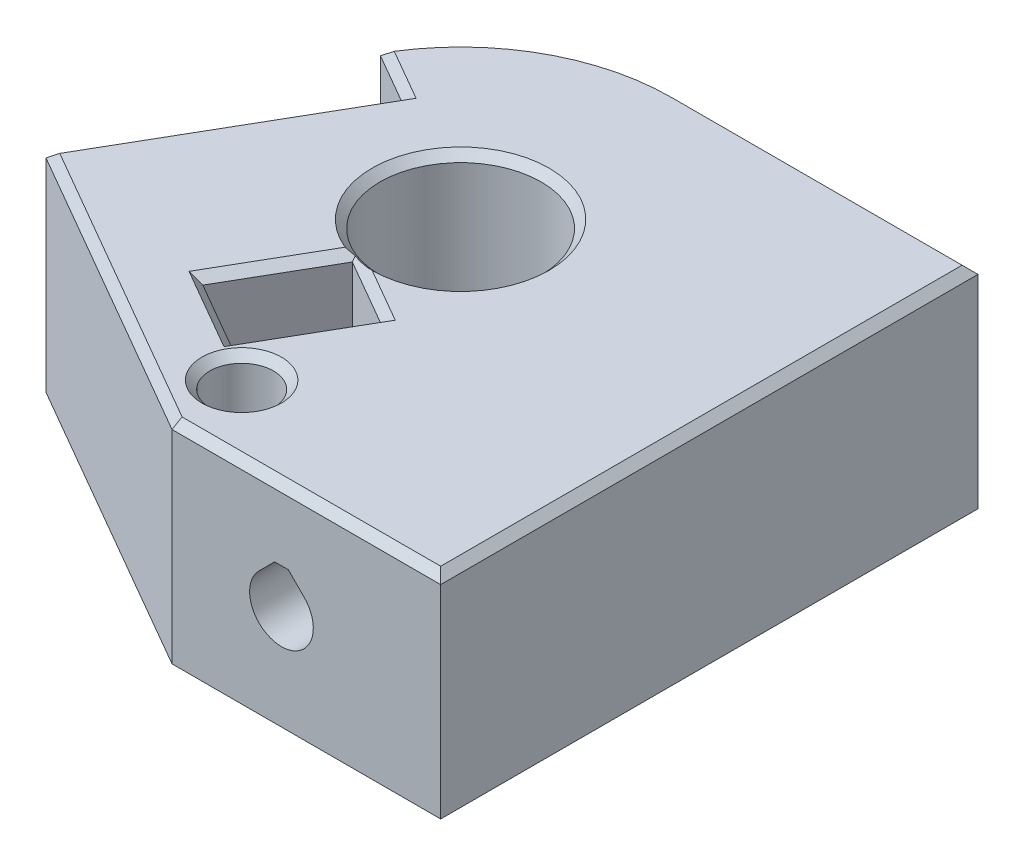
from build123d import *

# Parameters (mm, degrees)
SKETCH1_R           = 4.05
BOSS_EXTRUDE1_DEPTH = 11
SKETCH2_R           = 1.6
CUT_EXTRUDE1_DEPTH  = 47.310491369
SKETCH3_R           = 3.7
CUT_EXTRUDE2_DEPTH  = 11
SKETCH5_R           = 1.6
CUT_EXTRUDE4_DEPTH  = 47.310491451
SKETCH11_R          = 1.6
CUT_EXTRUDE10_DEPTH = 14
CUT_EXTRUDE9_START  = -9
CUT_EXTRUDE9_DEPTH  = 4
CUT_EXTRUDE15_DEPTH = 11
CUT_EXTRUDE16_DEPTH = 47.310491451
CUT_EXTRUDE17_REACH = 33.233


with BuildPart() as part:
    # Sketch1 → Boss-Extrude1 (new body)
    with BuildSketch(Plane(origin=(0, 0, 0), x_dir=(1, 0, 0), z_dir=(0, 1, 0))):
        with BuildLine():
            Line((-7.5, 0), (-21, 0))
            Line((-21, 0), (-35.981406461, 8.649519053))
            Line((-35.981406461, 8.649519053), (-29.42820323, 20))
            Line((-29.42820323, 20), (-32.026279442, 21.5))
            ThreePointArc((-32.026279442, 21.5), (-28, 25.526279442), (-22.5, 27))
            Line((-22.5, 27), (-7.5, 27))
            Line((-7.5, 27), (-7.5, 0))
        make_face()
        with Locations(Location((-22.5, 16, 0), (0, 0, 270))):
            Circle(SKETCH1_R, mode=Mode.SUBTRACT)
    extrude(amount=BOSS_EXTRUDE1_DEPTH)

    # Sketch2 → Cut-Extrude1 (cut, through all)
    with BuildSketch(Plane.XY):
        with Locations((-15.5, 5.5)):
            Circle(SKETCH2_R)
    extrude(amount=-CUT_EXTRUDE1_DEPTH, mode=Mode.SUBTRACT)

    # Sketch3 → Cut-Extrude2 (cut)
    with BuildSketch(Plane(origin=(0, 0, -27), x_dir=(-1, 0, 0), z_dir=(0, 0, -1))):
        with Locations((15.5, 5.5)):
            Circle(SKETCH3_R)
    extrude(amount=-CUT_EXTRUDE2_DEPTH, mode=Mode.SUBTRACT)

    # Sketch5 → Cut-Extrude4 (cut, through all)
    with BuildSketch(Plane(origin=(0, 11, 0), x_dir=(1, 0, 0), z_dir=(0, 1, 0))):
        with Locations(Location((-21, 3.5, 0), (0, 0, 270))):
            Circle(SKETCH5_R)
    extrude(amount=-CUT_EXTRUDE4_DEPTH, mode=Mode.SUBTRACT)

    # Sketch11 → Cut-Extrude10 (cut)
    with BuildSketch(Plane(origin=(-30.731406461, 0, -17.742785793), x_dir=(-0.49999999999999406, 0, 0.8660254037844421), z_dir=(-0.866025403784442, 0, -0.499999999999994))):
        with Locations((4.393593539, 5.5)):
            Circle(SKETCH11_R)
    extrude(amount=-CUT_EXTRUDE10_DEPTH, mode=Mode.SUBTRACT)

    # Sketch10 → Cut-Extrude9 (cut)
    with BuildSketch(Plane(origin=(-30.731406461, 0, -17.742785793), x_dir=(-0.49999999999999406, 0, 0.8660254037844421), z_dir=(-0.866025403784442, 0, -0.499999999999994)).offset(CUT_EXTRUDE9_START)):
        Polygon((1.643593539, 11), (7.143593539, 11), (7.143593539, 3.71228676), (4.393593539, 2.124573519), (1.643593539, 3.71228676), align=None)
    extrude(amount=-CUT_EXTRUDE9_DEPTH, mode=Mode.SUBTRACT)

    # Sketch17 → Cut-Extrude15 (cut)
    with BuildSketch(Plane(origin=(0, 0, -27), x_dir=(-1, 0, 0), z_dir=(0, 0, -1))):
        Polygon((15.5, 5.5), (18.11629509, 8.11629509), (16.292590181, 9.94), (14.707409819, 9.94), (12.88370491, 8.11629509), align=None)
    extrude(amount=-CUT_EXTRUDE15_DEPTH, mode=Mode.SUBTRACT)

    # Sketch18 → Cut-Extrude16 (cut, through all)
    with BuildSketch(Plane.XY):
        Polygon((-15.5, 5.5), (-14.36862915, 6.63137085), (-15.1572583, 7.42), (-15.8427417, 7.42), (-16.63137085, 6.63137085), align=None)
    extrude(amount=-CUT_EXTRUDE16_DEPTH, mode=Mode.SUBTRACT)

    # Cut-Extrude17: up to this face of the body (flat: up to its plane)
    cut_extrude17_end = Plane(part.part.faces().sort_by_distance((-20.803847577, 5.5, -6.937822174))[0])
    # Sketch19 → Cut-Extrude17 (cut, up to the picked face)
    with BuildSketch(Plane(origin=(-30.731406461, 0, -17.742785793), x_dir=(-0.49999999999999406, 0, 0.8660254037844421), z_dir=(-0.866025403784442, 0, -0.499999999999994)), mode=Mode.PRIVATE) as cut_extrude17_sk1:
        Polygon((4.393593539, 5.5), (5.524964389, 6.63137085), (4.736335239, 7.42), (4.05085184, 7.42), (3.26222269, 6.63137085), align=None)
    cut_extrude17_tool1 = split(extrude(cut_extrude17_sk1.sketch, amount=-CUT_EXTRUDE17_REACH, mode=Mode.PRIVATE), bisect_by=cut_extrude17_end, keep=Keep.BOTH, mode=Mode.PRIVATE)
    add(cut_extrude17_tool1.solids().sort_by(Axis((-32.928203, 6.587948, -13.937822), (0.866025403784442, 0, 0.499999999999994)))[0], mode=Mode.SUBTRACT)

    # Chamfer2
    # the kernel refuses this chamfer: 0.4 mm, written as the material it takes off along each edge
    with BuildSketch(Plane(origin=(-7.5, 11, -27), x_dir=(0.027495876610587302, -0.9996219169112966, 0), z_dir=(0, 0, 1)), Plane(origin=(-7.5, 0, -27), x_dir=(-0.9996219169112968, -0.027495876610586313, 0), z_dir=(0, 0, 1))) as chamfer2_piece_1:
        with BuildLine():
            Line((0.411469278, 0), (-0.022618862, -0.410847117))
            Line((-0.022618862, -0.410847117), (-0.030615837, -0.41062715))
            ThreePointArc((-0.030615837, -0.41062715), (-0.013651691, -0.205359132), (-0.007996975, 0.000219967))
            Line((-0.007996975, 0.000219967), (0.000219967, 0.007996975))
            ThreePointArc((0.000219967, 0.007996975), (0.205799066, 0.00234226), (0.411689245, 0.007996975))
            Line((0.411689245, 0.007996975), (0.411469278, 0))
        make_face()
    extrude(amount=27, mode=Mode.SUBTRACT)
    with BuildSketch(Plane(origin=(-22.5, 11, -27), x_dir=(0, -0.9996219169112966, -0.027495876610587302), z_dir=(1, 0, 0))) as chamfer2_piece_2:
        with BuildLine():
            Line((0.411469278, 0), (-0.022618862, -0.410847117))
            Line((-0.022618862, -0.410847117), (-0.030615837, -0.41062715))
            ThreePointArc((-0.030615837, -0.41062715), (-0.013651691, -0.205359132), (-0.007996975, 0.000219967))
            Line((-0.007996975, 0.000219967), (0.000219967, 0.007996975))
            ThreePointArc((0.000219967, 0.007996975), (0.205799066, 0.00234226), (0.411689245, 0.007996975))
            Line((0.411689245, 0.007996975), (0.411469278, 0))
        make_face()
    extrude(amount=15, mode=Mode.SUBTRACT)
    with BuildSketch(Plane(origin=(-22.5, 11, -16), x_dir=(-0.8660254037844412, 0, -0.4999999999999956), z_dir=(-0.4999999999999956, 0, 0.8660254037844412))) as chamfer2_piece_3:
        with BuildLine():
            Line((10.588686292, -0.011313708), (11.011313708, 0.411313708))
            Line((11.011313708, 0.411313708), (11.019313708, 0.411313708))
            ThreePointArc((11.019313708, 0.411313708), (11.008, 0.205656854), (11.008, 0))
            Line((11.008, 0), (11, -0.008))
            ThreePointArc((11, -0.008), (10.794343146, -0.008), (10.588686292, -0.019313708))
            Line((10.588686292, -0.019313708), (10.588686292, -0.011313708))
        make_face()
    revolve(axis=Axis((-22.5, 11, -16), (0, -1, 0)), revolution_arc=60, mode=Mode.SUBTRACT)
    with BuildSketch(Plane(origin=(-22.5, 0, -16), x_dir=(0, 0, 1), z_dir=(-1, 0, 0))) as chamfer2_piece_4:
        with BuildLine():
            Line((4.038686292, 0.411313708), (4.461313708, -0.011313708))
            Line((4.461313708, -0.011313708), (4.461313708, -0.019313708))
            ThreePointArc((4.461313708, -0.019313708), (4.255656854, -0.008), (4.05, -0.008))
            Line((4.05, -0.008), (4.042, 0))
            ThreePointArc((4.042, 0), (4.042, 0.205656854), (4.030686292, 0.411313708))
            Line((4.030686292, 0.411313708), (4.038686292, 0.411313708))
        make_face()
    revolve(axis=Axis((-22.5, 0, -16), (0, 1, 0)), mode=Mode.SUBTRACT)
    with BuildSketch(Plane(origin=(-22.5, 11, -16), x_dir=(0, 0, 1), z_dir=(-1, 0, 0))) as chamfer2_piece_5:
        with BuildLine():
            Line((4.038686292, -0.411313708), (4.461313708, 0.011313708))
            Line((4.461313708, 0.011313708), (4.461313708, 0.019313708))
            ThreePointArc((4.461313708, 0.019313708), (4.255656854, 0.008), (4.05, 0.008))
            Line((4.05, 0.008), (4.042, 0))
            ThreePointArc((4.042, 0), (4.042, -0.205656854), (4.030686292, -0.411313708))
            Line((4.030686292, -0.411313708), (4.038686292, -0.411313708))
        make_face()
    revolve(axis=Axis((-22.5, 11, -16), (0, 1, 0)), mode=Mode.SUBTRACT)
    with BuildSketch(Plane(origin=(-29.42820323, 11, -20), x_dir=(-0.013747938305293759, -0.9996219169112966, 0.023812127644091508), z_dir=(-0.8660254037844419, 0, -0.49999999999999445))) as chamfer2_piece_6_section:
        with BuildLine():
            Line((0.411469278, 0), (-0.022618862, -0.410847117))
            Line((-0.022618862, -0.410847117), (-0.030615837, -0.41062715))
            ThreePointArc((-0.030615837, -0.41062715), (-0.013651691, -0.205359132), (-0.007996975, 0.000219967))
            Line((-0.007996975, 0.000219967), (0.000219967, 0.007996975))
            ThreePointArc((0.000219967, 0.007996975), (0.205799066, 0.00234226), (0.411689245, 0.007996975))
            Line((0.411689245, 0.007996975), (0.411469278, 0))
        make_face()
    chamfer2_piece_6 = extrude(amount=4.028673195, mode=Mode.PRIVATE)
    chamfer2_piece_6 = chamfer2_piece_6 & Plane(origin=(-22.5, 10.868056462, -16), x_dir=(-0.8660254037844413, 0, -0.4999999999999957), z_dir=(0, -1, 0)) * Cylinder(11, 10, mode=Mode.PRIVATE)
    add(chamfer2_piece_6, mode=Mode.SUBTRACT)
    with BuildSketch(Plane(origin=(-35.981406461, 11, -8.649519053), x_dir=(-0.023812127644093392, -0.9996219169112966, -0.013747938305294813), z_dir=(0.4999999999999936, 0, -0.8660254037844424))) as chamfer2_piece_7:
        with BuildLine():
            Line((0.411469278, 0), (-0.022618862, -0.410847117))
            Line((-0.022618862, -0.410847117), (-0.030615837, -0.41062715))
            ThreePointArc((-0.030615837, -0.41062715), (-0.013651691, -0.205359132), (-0.007996975, 0.000219967))
            Line((-0.007996975, 0.000219967), (0.000219967, 0.007996975))
            ThreePointArc((0.000219967, 0.007996975), (0.205799066, 0.00234226), (0.411689245, 0.007996975))
            Line((0.411689245, 0.007996975), (0.411469278, 0))
        make_face()
    extrude(amount=13.106406461, mode=Mode.SUBTRACT)
    with BuildSketch(Plane(origin=(-20.109142881, 11, 0.514336598), x_dir=(-0.01374793830529188, -0.9996219169112968, 0.02381212764408828), z_dir=(-0.866025403784442, 0, -0.49999999999999406))) as chamfer2_piece_8_section:
        with BuildLine():
            Line((0.411469278, 0), (-0.022618862, -0.410847117))
            Line((-0.022618862, -0.410847117), (-0.030615837, -0.41062715))
            ThreePointArc((-0.030615837, -0.41062715), (-0.013651691, -0.205359132), (-0.007996975, 0.000219967))
            Line((-0.007996975, 0.000219967), (0.000219967, 0.007996975))
            ThreePointArc((0.000219967, 0.007996975), (0.205799066, 0.00234226), (0.411689245, 0.007996975))
            Line((0.411689245, 0.007996975), (0.411469278, 0))
        make_face()
    chamfer2_piece_8 = extrude(amount=18.327711301, mode=Mode.PRIVATE)
    chamfer2_piece_8 = split(chamfer2_piece_8, bisect_by=Plane(origin=(-28.324551367, 10.868619313, 0), z_dir=(0, 0, -1)), keep=Keep.TOP, mode=Mode.PRIVATE)
    add(chamfer2_piece_8, mode=Mode.SUBTRACT)
    with BuildSketch(Plane(origin=(-21, 0, -3.5), x_dir=(0, 0, 1), z_dir=(-1, 0, 0))) as chamfer2_piece_9:
        with BuildLine():
            Line((2.011313708, -0.011313708), (1.588686292, 0.411313708))
            Line((1.588686292, 0.411313708), (1.580686292, 0.411313708))
            ThreePointArc((1.580686292, 0.411313708), (1.592, 0.205656854), (1.592, 0))
            Line((1.592, 0), (1.6, -0.008))
            ThreePointArc((1.6, -0.008), (1.805656854, -0.008), (2.011313708, -0.019313708))
            Line((2.011313708, -0.019313708), (2.011313708, -0.011313708))
        make_face()
    revolve(axis=Axis((-21, 0, -3.5), (0, 1, 0)), mode=Mode.SUBTRACT)
    with BuildSketch(Plane(origin=(-21, 11, -3.5), x_dir=(0, 0, 1), z_dir=(-1, 0, 0))) as chamfer2_piece_10:
        with BuildLine():
            Line((1.588686292, -0.411313708), (2.011313708, 0.011313708))
            Line((2.011313708, 0.011313708), (2.011313708, 0.019313708))
            ThreePointArc((2.011313708, 0.019313708), (1.805656854, 0.008), (1.6, 0.008))
            Line((1.6, 0.008), (1.592, 0))
            ThreePointArc((1.592, 0), (1.592, -0.205656854), (1.580686292, -0.411313708))
            Line((1.580686292, -0.411313708), (1.588686292, -0.411313708))
        make_face()
    revolve(axis=Axis((-21, 11, -3.5), (0, 1, 0)), mode=Mode.SUBTRACT)
    with BuildSketch(Plane(origin=(-23.758974596, 11, -11.819392034), x_dir=(0.02381212764408691, -0.9996219169112968, 0.013747938305291089), z_dir=(-0.49999999999999406, 0, 0.8660254037844421))) as chamfer2_piece_11:
        with BuildLine():
            Line((0.411469278, 0), (-0.022618862, -0.410847117))
            Line((-0.022618862, -0.410847117), (-0.030615837, -0.41062715))
            ThreePointArc((-0.030615837, -0.41062715), (-0.013651691, -0.205359132), (-0.007996975, 0.000219967))
            Line((-0.007996975, 0.000219967), (0.000219967, 0.007996975))
            ThreePointArc((0.000219967, 0.007996975), (0.205799066, 0.00234226), (0.411689245, 0.007996975))
            Line((0.411689245, 0.007996975), (0.411469278, 0))
        make_face()
    extrude(amount=5.5, mode=Mode.SUBTRACT)
    with BuildSketch(Plane(origin=(-20.294872981, 11, -9.819392034), x_dir=(-0.02381212764409525, -0.9996219169112966, -0.013747938305295906), z_dir=(-0.49999999999999406, 0, 0.8660254037844421))) as chamfer2_piece_12:
        with BuildLine():
            Line((0.411469278, 0), (-0.022618862, 0.410847117))
            Line((-0.022618862, 0.410847117), (-0.030615837, 0.41062715))
            ThreePointArc((-0.030615837, 0.41062715), (-0.013651691, 0.205359132), (-0.007996975, -0.000219967))
            Line((-0.007996975, -0.000219967), (0.000219967, -0.007996975))
            ThreePointArc((0.000219967, -0.007996975), (0.205799066, -0.00234226), (0.411689245, -0.007996975))
            Line((0.411689245, -0.007996975), (0.411469278, 0))
        make_face()
    extrude(amount=5.5, mode=Mode.SUBTRACT)
    with BuildSketch(Plane(origin=(-23.758974596, 11, -11.819392034), x_dir=(-0.013747938305293748, -0.9996219169112966, 0.023812127644091515), z_dir=(0.8660254037844421, 0, 0.49999999999999406))) as chamfer2_piece_13:
        with BuildLine():
            Line((0.411469278, 0), (-0.022618862, 0.410847117))
            Line((-0.022618862, 0.410847117), (-0.030615837, 0.41062715))
            ThreePointArc((-0.030615837, 0.41062715), (-0.013651691, 0.205359132), (-0.007996975, -0.000219967))
            Line((-0.007996975, -0.000219967), (0.000219967, -0.007996975))
            ThreePointArc((0.000219967, -0.007996975), (0.205799066, -0.00234226), (0.411689245, -0.007996975))
            Line((0.411689245, -0.007996975), (0.411469278, 0))
        make_face()
    extrude(amount=4, mode=Mode.SUBTRACT)
    with BuildSketch(Plane(origin=(-26.508974596, 11, -7.056252313), x_dir=(0.01374793830529188, -0.9996219169112968, -0.02381212764408828), z_dir=(0.8660254037844421, 0, 0.49999999999999406))) as chamfer2_piece_14:
        with BuildLine():
            Line((0.411469278, 0), (-0.022618862, -0.410847117))
            Line((-0.022618862, -0.410847117), (-0.030615837, -0.41062715))
            ThreePointArc((-0.030615837, -0.41062715), (-0.013651691, -0.205359132), (-0.007996975, 0.000219967))
            Line((-0.007996975, 0.000219967), (0.000219967, 0.007996975))
            ThreePointArc((0.000219967, 0.007996975), (0.205799066, 0.00234226), (0.411689245, 0.007996975))
            Line((0.411689245, 0.007996975), (0.411469278, 0))
        make_face()
    extrude(amount=4, mode=Mode.SUBTRACT)
    with BuildSketch(Plane(origin=(-35.981406461, 0, -8.649519053), x_dir=(-0.023812127644093434, 0.9996219169112966, -0.013747938305294837), z_dir=(0.4999999999999936, 0, -0.8660254037844424))) as chamfer2_piece_15:
        with BuildLine():
            Line((0.411469278, 0), (-0.022618862, 0.410847117))
            Line((-0.022618862, 0.410847117), (-0.030615837, 0.41062715))
            ThreePointArc((-0.030615837, 0.41062715), (-0.013651691, 0.205359132), (-0.007996975, -0.000219967))
            Line((-0.007996975, -0.000219967), (0.000219967, -0.007996975))
            ThreePointArc((0.000219967, -0.007996975), (0.205799066, -0.00234226), (0.411689245, -0.007996975))
            Line((0.411689245, -0.007996975), (0.411469278, 0))
        make_face()
    extrude(amount=13.106406461, mode=Mode.SUBTRACT)
    with BuildSketch(Plane(origin=(-7.5, 11, 0), x_dir=(0, -0.9996219169112968, 0.027495876610586324), z_dir=(-1, 0, 0))) as chamfer2_piece_16_section:
        with BuildLine():
            Line((0.411469278, 0), (-0.022618862, -0.410847117))
            Line((-0.022618862, -0.410847117), (-0.030615837, -0.41062715))
            ThreePointArc((-0.030615837, -0.41062715), (-0.013651691, -0.205359132), (-0.007996975, 0.000219967))
            Line((-0.007996975, 0.000219967), (0.000219967, 0.007996975))
            ThreePointArc((0.000219967, 0.007996975), (0.205799066, 0.00234226), (0.411689245, 0.007996975))
            Line((0.411689245, 0.007996975), (0.411469278, 0))
        make_face()
    chamfer2_piece_16 = extrude(amount=14.528673195, mode=Mode.PRIVATE)
    chamfer2_piece_16 = split(chamfer2_piece_16, bisect_by=Plane(origin=(-16.081692511, 10.86876785, 2.839586153), z_dir=(0.49999999999999417, 0, -0.8660254037844423)), keep=Keep.TOP, mode=Mode.PRIVATE)
    add(chamfer2_piece_16, mode=Mode.SUBTRACT)
    with BuildSketch(Plane(origin=(-29.42820323, 0, -20), x_dir=(-0.013747938305293785, 0.9996219169112966, 0.023812127644091553), z_dir=(-0.8660254037844419, 0, -0.49999999999999445))) as chamfer2_piece_17_section:
        with BuildLine():
            Line((0.411469278, 0), (-0.022618862, 0.410847117))
            Line((-0.022618862, 0.410847117), (-0.030615837, 0.41062715))
            ThreePointArc((-0.030615837, 0.41062715), (-0.013651691, 0.205359132), (-0.007996975, -0.000219967))
            Line((-0.007996975, -0.000219967), (0.000219967, -0.007996975))
            ThreePointArc((0.000219967, -0.007996975), (0.205799066, -0.00234226), (0.411689245, -0.007996975))
            Line((0.411689245, -0.007996975), (0.411469278, 0))
        make_face()
    chamfer2_piece_17 = extrude(amount=4.028673195, mode=Mode.PRIVATE)
    chamfer2_piece_17 = chamfer2_piece_17 & Plane(origin=(-22.5, 0.131943538, -16), x_dir=(-0.8660254037844413, 0, -0.4999999999999957), z_dir=(0, -1, 0)) * Cylinder(11, 10, mode=Mode.PRIVATE)
    add(chamfer2_piece_17, mode=Mode.SUBTRACT)
    with BuildSketch(Plane(origin=(-22.5, 0, -16), x_dir=(-0.8660254037844412, 0, -0.4999999999999956), z_dir=(-0.4999999999999956, 0, 0.8660254037844412))) as chamfer2_piece_18:
        with BuildLine():
            Line((10.588686292, 0.011313708), (11.011313708, -0.411313708))
            Line((11.011313708, -0.411313708), (11.019313708, -0.411313708))
            ThreePointArc((11.019313708, -0.411313708), (11.008, -0.205656854), (11.008, 0))
            Line((11.008, 0), (11, 0.008))
            ThreePointArc((11, 0.008), (10.794343146, 0.008), (10.588686292, 0.019313708))
            Line((10.588686292, 0.019313708), (10.588686292, 0.011313708))
        make_face()
    revolve(axis=Axis((-22.5, 0, -16), (0, -1, 0)), revolution_arc=60, mode=Mode.SUBTRACT)
    with BuildSketch(Plane(origin=(-22.5, 0, -27), x_dir=(0, 0.9996219169112966, -0.02749587661058735), z_dir=(1, 0, 0))) as chamfer2_piece_19:
        with BuildLine():
            Line((0.411469278, 0), (-0.022618862, 0.410847117))
            Line((-0.022618862, 0.410847117), (-0.030615837, 0.41062715))
            ThreePointArc((-0.030615837, 0.41062715), (-0.013651691, 0.205359132), (-0.007996975, -0.000219967))
            Line((-0.007996975, -0.000219967), (0.000219967, -0.007996975))
            ThreePointArc((0.000219967, -0.007996975), (0.205799066, -0.00234226), (0.411689245, -0.007996975))
            Line((0.411689245, -0.007996975), (0.411469278, 0))
        make_face()
    extrude(amount=15, mode=Mode.SUBTRACT)
    with BuildSketch(Plane(origin=(-7.5, 0, 0), x_dir=(0, 0.9996219169112968, 0.027495876610586382), z_dir=(-1, 0, 0))) as chamfer2_piece_20_section:
        with BuildLine():
            Line((0.411469278, 0), (-0.022618862, 0.410847117))
            Line((-0.022618862, 0.410847117), (-0.030615837, 0.41062715))
            ThreePointArc((-0.030615837, 0.41062715), (-0.013651691, 0.205359132), (-0.007996975, -0.000219967))
            Line((-0.007996975, -0.000219967), (0.000219967, -0.007996975))
            ThreePointArc((0.000219967, -0.007996975), (0.205799066, -0.00234226), (0.411689245, -0.007996975))
            Line((0.411689245, -0.007996975), (0.411469278, 0))
        make_face()
    chamfer2_piece_20 = extrude(amount=14.528673195, mode=Mode.PRIVATE)
    chamfer2_piece_20 = split(chamfer2_piece_20, bisect_by=Plane(origin=(-16.081692511, 0.13123215, 2.839586153), z_dir=(0.49999999999999417, 0, -0.8660254037844423)), keep=Keep.TOP, mode=Mode.PRIVATE)
    add(chamfer2_piece_20, mode=Mode.SUBTRACT)
    with BuildSketch(Plane(origin=(-20.109142881, 0, 0.514336598), x_dir=(-0.013747938305292138, 0.9996219169112968, 0.02381212764408873), z_dir=(-0.866025403784442, 0, -0.49999999999999406))) as chamfer2_piece_21_section:
        with BuildLine():
            Line((0.411469278, 0), (-0.022618862, 0.410847117))
            Line((-0.022618862, 0.410847117), (-0.030615837, 0.41062715))
            ThreePointArc((-0.030615837, 0.41062715), (-0.013651691, 0.205359132), (-0.007996975, -0.000219967))
            Line((-0.007996975, -0.000219967), (0.000219967, -0.007996975))
            ThreePointArc((0.000219967, -0.007996975), (0.205799066, -0.00234226), (0.411689245, -0.007996975))
            Line((0.411689245, -0.007996975), (0.411469278, 0))
        make_face()
    chamfer2_piece_21 = extrude(amount=18.327711301, mode=Mode.PRIVATE)
    chamfer2_piece_21 = split(chamfer2_piece_21, bisect_by=Plane(origin=(-28.324551367, 0.131380687, 0), z_dir=(0, 0, -1)), keep=Keep.TOP, mode=Mode.PRIVATE)
    add(chamfer2_piece_21, mode=Mode.SUBTRACT)
    with BuildSketch(Plane(origin=(-22.5, 11, -27), x_dir=(0, -0.9996219169112966, -0.027495876610587302), z_dir=(1, 0, 0))) as chamfer2_piece_22a_section:
        with BuildLine():
            Line((0.411469278, 0), (-0.022618862, -0.410847117))
            Line((-0.022618862, -0.410847117), (-0.030615837, -0.41062715))
            ThreePointArc((-0.030615837, -0.41062715), (-0.013651691, -0.205359132), (-0.007996975, 0.000219967))
            Line((-0.007996975, 0.000219967), (0.000219967, 0.007996975))
            ThreePointArc((0.000219967, 0.007996975), (0.205799066, 0.00234226), (0.411689245, 0.007996975))
            Line((0.411689245, 0.007996975), (0.411469278, 0))
        make_face()
    chamfer2_piece_22a = extrude(amount=16.028673195, mode=Mode.PRIVATE)
    chamfer2_piece_22a = split(chamfer2_piece_22a, bisect_by=Plane(origin=(-7.5, 10.868082549, -26.868082549), z_dir=(1, 0, 0)), keep=Keep.TOP, mode=Mode.PRIVATE)
    with BuildSketch(Plane(origin=(-7.5, 11, -28.028673195), x_dir=(0.027495876610587302, -0.9996219169112966, 0), z_dir=(0, 0, 1))) as chamfer2_piece_22b_section:
        with BuildLine():
            Line((0.411469278, 0), (-0.022618862, -0.410847117))
            Line((-0.022618862, -0.410847117), (-0.030615837, -0.41062715))
            ThreePointArc((-0.030615837, -0.41062715), (-0.013651691, -0.205359132), (-0.007996975, 0.000219967))
            Line((-0.007996975, 0.000219967), (0.000219967, 0.007996975))
            ThreePointArc((0.000219967, 0.007996975), (0.205799066, 0.00234226), (0.411689245, 0.007996975))
            Line((0.411689245, 0.007996975), (0.411469278, 0))
        make_face()
    chamfer2_piece_22b = extrude(amount=28.028673195, mode=Mode.PRIVATE)
    chamfer2_piece_22b = split(chamfer2_piece_22b, bisect_by=Plane(origin=(-7.631917451, 10.868082549, -27), z_dir=(0, 0, -1)), keep=Keep.TOP, mode=Mode.PRIVATE)
    chamfer2_piece_22 = chamfer2_piece_22a & chamfer2_piece_22b
    add(chamfer2_piece_22, mode=Mode.SUBTRACT)
    with BuildSketch(Plane(origin=(-6.471326805, 11, 0), x_dir=(0, -0.9996219169112968, 0.027495876610586306), z_dir=(-1, 0, 0))) as chamfer2_piece_23a_section:
        with BuildLine():
            Line((0.411469278, 0), (-0.022618862, -0.410847117))
            Line((-0.022618862, -0.410847117), (-0.030615837, -0.41062715))
            ThreePointArc((-0.030615837, -0.41062715), (-0.013651691, -0.205359132), (-0.007996975, 0.000219967))
            Line((-0.007996975, 0.000219967), (0.000219967, 0.007996975))
            ThreePointArc((0.000219967, 0.007996975), (0.205799066, 0.00234226), (0.411689245, 0.007996975))
            Line((0.411689245, 0.007996975), (0.411469278, 0))
        make_face()
    chamfer2_piece_23a = extrude(amount=15.55734639, mode=Mode.PRIVATE)
    chamfer2_piece_23a = split(chamfer2_piece_23a, bisect_by=Plane(origin=(-7.5, 10.868082549, -0.131917451), z_dir=(1, 0, 0)), keep=Keep.TOP, mode=Mode.PRIVATE)
    with BuildSketch(Plane(origin=(-7.5, 11, -27), x_dir=(0.027495876610587302, -0.9996219169112966, 0), z_dir=(0, 0, 1))) as chamfer2_piece_23b_section:
        with BuildLine():
            Line((0.411469278, 0), (-0.022618862, -0.410847117))
            Line((-0.022618862, -0.410847117), (-0.030615837, -0.41062715))
            ThreePointArc((-0.030615837, -0.41062715), (-0.013651691, -0.205359132), (-0.007996975, 0.000219967))
            Line((-0.007996975, 0.000219967), (0.000219967, 0.007996975))
            ThreePointArc((0.000219967, 0.007996975), (0.205799066, 0.00234226), (0.411689245, 0.007996975))
            Line((0.411689245, 0.007996975), (0.411469278, 0))
        make_face()
    chamfer2_piece_23b = extrude(amount=28.028673195, mode=Mode.PRIVATE)
    chamfer2_piece_23b = split(chamfer2_piece_23b, bisect_by=Plane(origin=(-7.631917451, 10.868082549, 0), z_dir=(0, 0, 1)), keep=Keep.TOP, mode=Mode.PRIVATE)
    chamfer2_piece_23 = chamfer2_piece_23a & chamfer2_piece_23b
    add(chamfer2_piece_23, mode=Mode.SUBTRACT)
    with BuildSketch(Plane(origin=(-29.42820323, 11, -20), x_dir=(-0.013747938305293759, -0.9996219169112966, 0.023812127644091508), z_dir=(-0.8660254037844419, 0, -0.49999999999999445))) as chamfer2_piece_24a_section:
        with BuildLine():
            Line((0.411469278, 0), (-0.022618862, -0.410847117))
            Line((-0.022618862, -0.410847117), (-0.030615837, -0.41062715))
            ThreePointArc((-0.030615837, -0.41062715), (-0.013651691, -0.205359132), (-0.007996975, 0.000219967))
            Line((-0.007996975, 0.000219967), (0.000219967, 0.007996975))
            ThreePointArc((0.000219967, 0.007996975), (0.205799066, 0.00234226), (0.411689245, 0.007996975))
            Line((0.411689245, 0.007996975), (0.411469278, 0))
        make_face()
    chamfer2_piece_24a = extrude(amount=4.028673195, mode=Mode.PRIVATE)
    chamfer2_piece_24a = chamfer2_piece_24a - Plane(origin=(-22.5, 10.868158505, -16), x_dir=(-0.8660254037844413, 0, -0.4999999999999957), z_dir=(0, -1, 0)) * Cylinder(11, 10, mode=Mode.PRIVATE)
    with BuildSketch(Plane(origin=(-22.5, 11, -16), x_dir=(-0.9089380936445789, 0, -0.41693109972963), z_dir=(-0.41693109972963, 0, 0.9089380936445789))) as chamfer2_piece_24b_section:
        with BuildLine():
            Line((10.588686292, -0.011313708), (11.011313708, 0.411313708))
            Line((11.011313708, 0.411313708), (11.019313708, 0.411313708))
            ThreePointArc((11.019313708, 0.411313708), (11.008, 0.205656854), (11.008, 0))
            Line((11.008, 0), (11, -0.008))
            ThreePointArc((11, -0.008), (10.794343146, -0.008), (10.588686292, -0.019313708))
            Line((10.588686292, -0.019313708), (10.588686292, -0.011313708))
        make_face()
    chamfer2_piece_24b = revolve(axis=Axis((-22.5, 11, -16), (0, -1, 0)), revolution_arc=65.359013969, mode=Mode.PRIVATE)
    chamfer2_piece_24b = split(chamfer2_piece_24b, bisect_by=Plane(origin=(-31.899126681, 10.867582823, -21.426588319), z_dir=(-0.49999999999999445, 0, 0.8660254037844419)), keep=Keep.TOP, mode=Mode.PRIVATE)
    chamfer2_piece_24 = chamfer2_piece_24a & chamfer2_piece_24b
    add(chamfer2_piece_24, mode=Mode.SUBTRACT)
    with BuildSketch(Plane(origin=(-35.981406461, 11, -8.649519053), x_dir=(-0.023812127644093392, -0.9996219169112966, -0.013747938305294813), z_dir=(0.4999999999999936, 0, -0.8660254037844424))) as chamfer2_piece_25a_section:
        with BuildLine():
            Line((0.411469278, 0), (-0.022618862, -0.410847117))
            Line((-0.022618862, -0.410847117), (-0.030615837, -0.41062715))
            ThreePointArc((-0.030615837, -0.41062715), (-0.013651691, -0.205359132), (-0.007996975, 0.000219967))
            Line((-0.007996975, 0.000219967), (0.000219967, 0.007996975))
            ThreePointArc((0.000219967, 0.007996975), (0.205799066, 0.00234226), (0.411689245, 0.007996975))
            Line((0.411689245, 0.007996975), (0.411469278, 0))
        make_face()
    chamfer2_piece_25a = extrude(amount=14.135079656, mode=Mode.PRIVATE)
    chamfer2_piece_25a = split(chamfer2_piece_25a, bisect_by=Plane(origin=(-29.313959367, 10.868082549, -19.934041275), z_dir=(0.49999999999999445, 0, -0.8660254037844419)), keep=Keep.TOP, mode=Mode.PRIVATE)
    with BuildSketch(Plane(origin=(-28.537346111, 11, -19.485663402), x_dir=(-0.013747938305292178, -0.9996219169112968, 0.023812127644088774), z_dir=(-0.8660254037844419, 0, -0.49999999999999445))) as chamfer2_piece_25b_section:
        with BuildLine():
            Line((0.411469278, 0), (-0.022618862, -0.410847117))
            Line((-0.022618862, -0.410847117), (-0.030615837, -0.41062715))
            ThreePointArc((-0.030615837, -0.41062715), (-0.013651691, -0.205359132), (-0.007996975, 0.000219967))
            Line((-0.007996975, 0.000219967), (0.000219967, 0.007996975))
            ThreePointArc((0.000219967, 0.007996975), (0.205799066, 0.00234226), (0.411689245, 0.007996975))
            Line((0.411689245, 0.007996975), (0.411469278, 0))
        make_face()
    chamfer2_piece_25b = extrude(amount=5.05734639, mode=Mode.PRIVATE)
    chamfer2_piece_25b = split(chamfer2_piece_25b, bisect_by=Plane(origin=(-29.362244505, 10.868082549, -20.114243864), z_dir=(0.8660254037844424, 0, 0.4999999999999936)), keep=Keep.TOP, mode=Mode.PRIVATE)
    chamfer2_piece_25 = chamfer2_piece_25a & chamfer2_piece_25b
    add(chamfer2_piece_25, mode=Mode.SUBTRACT)
    with BuildSketch(Plane(origin=(-20.109142881, 11, 0.514336598), x_dir=(-0.01374793830529188, -0.9996219169112968, 0.02381212764408828), z_dir=(-0.866025403784442, 0, -0.49999999999999406))) as chamfer2_piece_26a_section:
        with BuildLine():
            Line((0.411469278, 0), (-0.022618862, -0.410847117))
            Line((-0.022618862, -0.410847117), (-0.030615837, -0.41062715))
            ThreePointArc((-0.030615837, -0.41062715), (-0.013651691, -0.205359132), (-0.007996975, 0.000219967))
            Line((-0.007996975, 0.000219967), (0.000219967, 0.007996975))
            ThreePointArc((0.000219967, 0.007996975), (0.205799066, 0.00234226), (0.411689245, 0.007996975))
            Line((0.411689245, 0.007996975), (0.411469278, 0))
        make_face()
    chamfer2_piece_26a = extrude(amount=19.356384496, mode=Mode.PRIVATE)
    chamfer2_piece_26a = split(chamfer2_piece_26a, bisect_by=Plane(origin=(-35.915447735, 10.868082549, -8.763762916), z_dir=(-0.8660254037844424, 0, -0.4999999999999936)), keep=Keep.TOP, mode=Mode.PRIVATE)
    with BuildSketch(Plane(origin=(-36.495743058, 11, -7.758661934), x_dir=(-0.023812127644092455, -0.9996219169112966, -0.013747938305294274), z_dir=(0.4999999999999936, 0, -0.8660254037844424))) as chamfer2_piece_26b_section:
        with BuildLine():
            Line((0.411469278, 0), (-0.022618862, -0.410847117))
            Line((-0.022618862, -0.410847117), (-0.030615837, -0.41062715))
            ThreePointArc((-0.030615837, -0.41062715), (-0.013651691, -0.205359132), (-0.007996975, 0.000219967))
            Line((-0.007996975, 0.000219967), (0.000219967, 0.007996975))
            ThreePointArc((0.000219967, 0.007996975), (0.205799066, 0.00234226), (0.411689245, 0.007996975))
            Line((0.411689245, 0.007996975), (0.411469278, 0))
        make_face()
    chamfer2_piece_26b = extrude(amount=14.135079656, mode=Mode.PRIVATE)
    chamfer2_piece_26b = split(chamfer2_piece_26b, bisect_by=Plane(origin=(-35.867162597, 10.868082549, -8.583560327), z_dir=(-0.49999999999999417, 0, 0.8660254037844423)), keep=Keep.TOP, mode=Mode.PRIVATE)
    chamfer2_piece_26 = chamfer2_piece_26a & chamfer2_piece_26b
    add(chamfer2_piece_26, mode=Mode.SUBTRACT)
    with BuildSketch(Plane(origin=(-7.5, 11, 0), x_dir=(0, -0.9996219169112968, 0.027495876610586324), z_dir=(-1, 0, 0))) as chamfer2_piece_27a_section:
        with BuildLine():
            Line((0.411469278, 0), (-0.022618862, -0.410847117))
            Line((-0.022618862, -0.410847117), (-0.030615837, -0.41062715))
            ThreePointArc((-0.030615837, -0.41062715), (-0.013651691, -0.205359132), (-0.007996975, 0.000219967))
            Line((-0.007996975, 0.000219967), (0.000219967, 0.007996975))
            ThreePointArc((0.000219967, 0.007996975), (0.205799066, 0.00234226), (0.411689245, 0.007996975))
            Line((0.411689245, 0.007996975), (0.411469278, 0))
        make_face()
    chamfer2_piece_27a = extrude(amount=14.528673195, mode=Mode.PRIVATE)
    chamfer2_piece_27a = split(chamfer2_piece_27a, bisect_by=Plane(origin=(-21.504749343, 10.856325089, -0.291417169), z_dir=(-0.49999999999999417, 0, 0.8660254037844423)), keep=Keep.TOP, mode=Mode.PRIVATE)
    with BuildSketch(Plane(origin=(-20.109142881, 11, 0.514336598), x_dir=(-0.01374793830529188, -0.9996219169112968, 0.02381212764408828), z_dir=(-0.866025403784442, 0, -0.49999999999999406))) as chamfer2_piece_27b_section:
        with BuildLine():
            Line((0.411469278, 0), (-0.022618862, -0.410847117))
            Line((-0.022618862, -0.410847117), (-0.030615837, -0.41062715))
            ThreePointArc((-0.030615837, -0.41062715), (-0.013651691, -0.205359132), (-0.007996975, 0.000219967))
            Line((-0.007996975, 0.000219967), (0.000219967, 0.007996975))
            ThreePointArc((0.000219967, 0.007996975), (0.205799066, 0.00234226), (0.411689245, 0.007996975))
            Line((0.411689245, 0.007996975), (0.411469278, 0))
        make_face()
    chamfer2_piece_27b = extrude(amount=18.327711301, mode=Mode.PRIVATE)
    chamfer2_piece_27b = split(chamfer2_piece_27b, bisect_by=Plane(origin=(-20.417165661, 10.856325089, 0), z_dir=(0, 0, 1)), keep=Keep.TOP, mode=Mode.PRIVATE)
    chamfer2_piece_27 = chamfer2_piece_27a & chamfer2_piece_27b
    add(chamfer2_piece_27, mode=Mode.SUBTRACT)
    with BuildSketch(Plane(origin=(-23.244637999, 11, -12.710249153), x_dir=(0.023812127644093385, -0.9996219169112966, 0.013747938305294827), z_dir=(-0.49999999999999406, 0, 0.8660254037844421))) as chamfer2_piece_28a_section:
        with BuildLine():
            Line((0.411469278, 0), (-0.022618862, -0.410847117))
            Line((-0.022618862, -0.410847117), (-0.030615837, -0.41062715))
            ThreePointArc((-0.030615837, -0.41062715), (-0.013651691, -0.205359132), (-0.007996975, 0.000219967))
            Line((-0.007996975, 0.000219967), (0.000219967, 0.007996975))
            ThreePointArc((0.000219967, 0.007996975), (0.205799066, 0.00234226), (0.411689245, 0.007996975))
            Line((0.411689245, 0.007996975), (0.411469278, 0))
        make_face()
    chamfer2_piece_28a = extrude(amount=6.528673195, mode=Mode.PRIVATE)
    chamfer2_piece_28a = split(chamfer2_piece_28a, bisect_by=Plane(origin=(-23.87321846, 10.868082549, -11.885350759), z_dir=(0.49999999999999406, 0, -0.8660254037844421)), keep=Keep.TOP, mode=Mode.PRIVATE)
    with BuildSketch(Plane(origin=(-24.649831715, 11, -12.333728632), x_dir=(-0.013747938305292168, -0.9996219169112968, 0.023812127644088785), z_dir=(0.8660254037844421, 0, 0.49999999999999406))) as chamfer2_piece_28b_section:
        with BuildLine():
            Line((0.411469278, 0), (-0.022618862, 0.410847117))
            Line((-0.022618862, 0.410847117), (-0.030615837, 0.41062715))
            ThreePointArc((-0.030615837, 0.41062715), (-0.013651691, 0.205359132), (-0.007996975, -0.000219967))
            Line((-0.007996975, -0.000219967), (0.000219967, -0.007996975))
            ThreePointArc((0.000219967, -0.007996975), (0.205799066, -0.00234226), (0.411689245, -0.007996975))
            Line((0.411689245, -0.007996975), (0.411469278, 0))
        make_face()
    chamfer2_piece_28b = extrude(amount=5.028673195, mode=Mode.PRIVATE)
    chamfer2_piece_28b = split(chamfer2_piece_28b, bisect_by=Plane(origin=(-23.693015871, 10.868082549, -11.933635897), z_dir=(-0.8660254037844421, 0, -0.49999999999999406)), keep=Keep.TOP, mode=Mode.PRIVATE)
    chamfer2_piece_28 = chamfer2_piece_28a & chamfer2_piece_28b
    add(chamfer2_piece_28, mode=Mode.SUBTRACT)
    with BuildSketch(Plane(origin=(-23.758974596, 11, -11.819392034), x_dir=(0.02381212764408691, -0.9996219169112968, 0.013747938305291089), z_dir=(-0.49999999999999406, 0, 0.8660254037844421))) as chamfer2_piece_29a_section:
        with BuildLine():
            Line((0.411469278, 0), (-0.022618862, -0.410847117))
            Line((-0.022618862, -0.410847117), (-0.030615837, -0.41062715))
            ThreePointArc((-0.030615837, -0.41062715), (-0.013651691, -0.205359132), (-0.007996975, 0.000219967))
            Line((-0.007996975, 0.000219967), (0.000219967, 0.007996975))
            ThreePointArc((0.000219967, 0.007996975), (0.205799066, 0.00234226), (0.411689245, 0.007996975))
            Line((0.411689245, 0.007996975), (0.411469278, 0))
        make_face()
    chamfer2_piece_29a = extrude(amount=6.528673195, mode=Mode.PRIVATE)
    chamfer2_piece_29a = split(chamfer2_piece_29a, bisect_by=Plane(origin=(-26.62321846, 10.868082549, -7.122211038), z_dir=(-0.49999999999999406, 0, 0.8660254037844421)), keep=Keep.TOP, mode=Mode.PRIVATE)
    with BuildSketch(Plane(origin=(-27.399831715, 11, -7.570588911), x_dir=(0.013747938305292168, -0.9996219169112968, -0.023812127644088785), z_dir=(0.8660254037844421, 0, 0.49999999999999406))) as chamfer2_piece_29b_section:
        with BuildLine():
            Line((0.411469278, 0), (-0.022618862, -0.410847117))
            Line((-0.022618862, -0.410847117), (-0.030615837, -0.41062715))
            ThreePointArc((-0.030615837, -0.41062715), (-0.013651691, -0.205359132), (-0.007996975, 0.000219967))
            Line((-0.007996975, 0.000219967), (0.000219967, 0.007996975))
            ThreePointArc((0.000219967, 0.007996975), (0.205799066, 0.00234226), (0.411689245, 0.007996975))
            Line((0.411689245, 0.007996975), (0.411469278, 0))
        make_face()
    chamfer2_piece_29b = extrude(amount=5.028673195, mode=Mode.PRIVATE)
    chamfer2_piece_29b = split(chamfer2_piece_29b, bisect_by=Plane(origin=(-26.574933322, 10.868082549, -6.94200845), z_dir=(-0.8660254037844421, 0, -0.49999999999999406)), keep=Keep.TOP, mode=Mode.PRIVATE)
    chamfer2_piece_29 = chamfer2_piece_29a & chamfer2_piece_29b
    add(chamfer2_piece_29, mode=Mode.SUBTRACT)
    with BuildSketch(Plane(origin=(-23.758974596, 11, -11.819392034), x_dir=(-0.013747938305293748, -0.9996219169112966, 0.023812127644091515), z_dir=(0.8660254037844421, 0, 0.49999999999999406))) as chamfer2_piece_30a_section:
        with BuildLine():
            Line((0.411469278, 0), (-0.022618862, 0.410847117))
            Line((-0.022618862, 0.410847117), (-0.030615837, 0.41062715))
            ThreePointArc((-0.030615837, 0.41062715), (-0.013651691, 0.205359132), (-0.007996975, -0.000219967))
            Line((-0.007996975, -0.000219967), (0.000219967, -0.007996975))
            ThreePointArc((0.000219967, -0.007996975), (0.205799066, -0.00234226), (0.411689245, -0.007996975))
            Line((0.411689245, -0.007996975), (0.411469278, 0))
        make_face()
    chamfer2_piece_30a = extrude(amount=5.028673195, mode=Mode.PRIVATE)
    chamfer2_piece_30a = split(chamfer2_piece_30a, bisect_by=Plane(origin=(-20.228914256, 10.868082549, -9.933635897), z_dir=(0.8660254037844421, 0, 0.49999999999999406)), keep=Keep.TOP, mode=Mode.PRIVATE)
    with BuildSketch(Plane(origin=(-19.780536383, 11, -10.710249153), x_dir=(-0.023812127644093385, -0.9996219169112966, -0.013747938305294827), z_dir=(-0.49999999999999406, 0, 0.8660254037844421))) as chamfer2_piece_30b_section:
        with BuildLine():
            Line((0.411469278, 0), (-0.022618862, 0.410847117))
            Line((-0.022618862, 0.410847117), (-0.030615837, 0.41062715))
            ThreePointArc((-0.030615837, 0.41062715), (-0.013651691, 0.205359132), (-0.007996975, -0.000219967))
            Line((-0.007996975, -0.000219967), (0.000219967, -0.007996975))
            ThreePointArc((0.000219967, -0.007996975), (0.205799066, -0.00234226), (0.411689245, -0.007996975))
            Line((0.411689245, -0.007996975), (0.411469278, 0))
        make_face()
    chamfer2_piece_30b = extrude(amount=6.528673195, mode=Mode.PRIVATE)
    chamfer2_piece_30b = split(chamfer2_piece_30b, bisect_by=Plane(origin=(-20.180629118, 10.868082549, -9.753433309), z_dir=(0.49999999999999406, 0, -0.8660254037844421)), keep=Keep.TOP, mode=Mode.PRIVATE)
    chamfer2_piece_30 = chamfer2_piece_30a & chamfer2_piece_30b
    add(chamfer2_piece_30, mode=Mode.SUBTRACT)
    with BuildSketch(Plane(origin=(-20.294872981, 11, -9.819392034), x_dir=(-0.02381212764409525, -0.9996219169112966, -0.013747938305295906), z_dir=(-0.49999999999999406, 0, 0.8660254037844421))) as chamfer2_piece_31a_section:
        with BuildLine():
            Line((0.411469278, 0), (-0.022618862, 0.410847117))
            Line((-0.022618862, 0.410847117), (-0.030615837, 0.41062715))
            ThreePointArc((-0.030615837, 0.41062715), (-0.013651691, 0.205359132), (-0.007996975, -0.000219967))
            Line((-0.007996975, -0.000219967), (0.000219967, -0.007996975))
            ThreePointArc((0.000219967, -0.007996975), (0.205799066, -0.00234226), (0.411689245, -0.007996975))
            Line((0.411689245, -0.007996975), (0.411469278, 0))
        make_face()
    chamfer2_piece_31a = extrude(amount=6.528673195, mode=Mode.PRIVATE)
    chamfer2_piece_31a = split(chamfer2_piece_31a, bisect_by=Plane(origin=(-22.930629118, 10.868082549, -4.990293588), z_dir=(-0.49999999999999406, 0, 0.8660254037844421)), keep=Keep.TOP, mode=Mode.PRIVATE)
    with BuildSketch(Plane(origin=(-26.508974596, 11, -7.056252313), x_dir=(0.01374793830529188, -0.9996219169112968, -0.02381212764408828), z_dir=(0.8660254037844421, 0, 0.49999999999999406))) as chamfer2_piece_31b_section:
        with BuildLine():
            Line((0.411469278, 0), (-0.022618862, -0.410847117))
            Line((-0.022618862, -0.410847117), (-0.030615837, -0.41062715))
            ThreePointArc((-0.030615837, -0.41062715), (-0.013651691, -0.205359132), (-0.007996975, 0.000219967))
            Line((-0.007996975, 0.000219967), (0.000219967, 0.007996975))
            ThreePointArc((0.000219967, 0.007996975), (0.205799066, 0.00234226), (0.411689245, 0.007996975))
            Line((0.411689245, 0.007996975), (0.411469278, 0))
        make_face()
    chamfer2_piece_31b = extrude(amount=5.028673195, mode=Mode.PRIVATE)
    chamfer2_piece_31b = split(chamfer2_piece_31b, bisect_by=Plane(origin=(-23.110831706, 10.868082549, -4.94200845), z_dir=(0.8660254037844421, 0, 0.49999999999999406)), keep=Keep.TOP, mode=Mode.PRIVATE)
    chamfer2_piece_31 = chamfer2_piece_31a & chamfer2_piece_31b
    add(chamfer2_piece_31, mode=Mode.SUBTRACT)
    with BuildSketch(Plane(origin=(-20.109142881, 0, 0.514336598), x_dir=(-0.013747938305292138, 0.9996219169112968, 0.02381212764408873), z_dir=(-0.866025403784442, 0, -0.49999999999999406))) as chamfer2_piece_32a_section:
        with BuildLine():
            Line((0.411469278, 0), (-0.022618862, 0.410847117))
            Line((-0.022618862, 0.410847117), (-0.030615837, 0.41062715))
            ThreePointArc((-0.030615837, 0.41062715), (-0.013651691, 0.205359132), (-0.007996975, -0.000219967))
            Line((-0.007996975, -0.000219967), (0.000219967, -0.007996975))
            ThreePointArc((0.000219967, -0.007996975), (0.205799066, -0.00234226), (0.411689245, -0.007996975))
            Line((0.411689245, -0.007996975), (0.411469278, 0))
        make_face()
    chamfer2_piece_32a = extrude(amount=19.356384496, mode=Mode.PRIVATE)
    chamfer2_piece_32a = split(chamfer2_piece_32a, bisect_by=Plane(origin=(-35.915447735, 0.131917451, -8.763762916), z_dir=(-0.8660254037844424, 0, -0.4999999999999936)), keep=Keep.TOP, mode=Mode.PRIVATE)
    with BuildSketch(Plane(origin=(-36.495743058, 0, -7.758661934), x_dir=(-0.023812127644092494, 0.9996219169112966, -0.013747938305294296), z_dir=(0.4999999999999936, 0, -0.8660254037844424))) as chamfer2_piece_32b_section:
        with BuildLine():
            Line((0.411469278, 0), (-0.022618862, 0.410847117))
            Line((-0.022618862, 0.410847117), (-0.030615837, 0.41062715))
            ThreePointArc((-0.030615837, 0.41062715), (-0.013651691, 0.205359132), (-0.007996975, -0.000219967))
            Line((-0.007996975, -0.000219967), (0.000219967, -0.007996975))
            ThreePointArc((0.000219967, -0.007996975), (0.205799066, -0.00234226), (0.411689245, -0.007996975))
            Line((0.411689245, -0.007996975), (0.411469278, 0))
        make_face()
    chamfer2_piece_32b = extrude(amount=14.135079656, mode=Mode.PRIVATE)
    chamfer2_piece_32b = split(chamfer2_piece_32b, bisect_by=Plane(origin=(-35.867162597, 0.131917451, -8.583560327), z_dir=(-0.49999999999999417, 0, 0.8660254037844423)), keep=Keep.TOP, mode=Mode.PRIVATE)
    chamfer2_piece_32 = chamfer2_piece_32a & chamfer2_piece_32b
    add(chamfer2_piece_32, mode=Mode.SUBTRACT)
    with BuildSketch(Plane(origin=(-35.981406461, 0, -8.649519053), x_dir=(-0.023812127644093434, 0.9996219169112966, -0.013747938305294837), z_dir=(0.4999999999999936, 0, -0.8660254037844424))) as chamfer2_piece_33a_section:
        with BuildLine():
            Line((0.411469278, 0), (-0.022618862, 0.410847117))
            Line((-0.022618862, 0.410847117), (-0.030615837, 0.41062715))
            ThreePointArc((-0.030615837, 0.41062715), (-0.013651691, 0.205359132), (-0.007996975, -0.000219967))
            Line((-0.007996975, -0.000219967), (0.000219967, -0.007996975))
            ThreePointArc((0.000219967, -0.007996975), (0.205799066, -0.00234226), (0.411689245, -0.007996975))
            Line((0.411689245, -0.007996975), (0.411469278, 0))
        make_face()
    chamfer2_piece_33a = extrude(amount=14.135079656, mode=Mode.PRIVATE)
    chamfer2_piece_33a = split(chamfer2_piece_33a, bisect_by=Plane(origin=(-29.313959367, 0.131917451, -19.934041275), z_dir=(0.49999999999999445, 0, -0.8660254037844419)), keep=Keep.TOP, mode=Mode.PRIVATE)
    with BuildSketch(Plane(origin=(-28.537346111, 0, -19.485663402), x_dir=(-0.013747938305292202, 0.9996219169112968, 0.023812127644088816), z_dir=(-0.8660254037844419, 0, -0.49999999999999445))) as chamfer2_piece_33b_section:
        with BuildLine():
            Line((0.411469278, 0), (-0.022618862, 0.410847117))
            Line((-0.022618862, 0.410847117), (-0.030615837, 0.41062715))
            ThreePointArc((-0.030615837, 0.41062715), (-0.013651691, 0.205359132), (-0.007996975, -0.000219967))
            Line((-0.007996975, -0.000219967), (0.000219967, -0.007996975))
            ThreePointArc((0.000219967, -0.007996975), (0.205799066, -0.00234226), (0.411689245, -0.007996975))
            Line((0.411689245, -0.007996975), (0.411469278, 0))
        make_face()
    chamfer2_piece_33b = extrude(amount=5.05734639, mode=Mode.PRIVATE)
    chamfer2_piece_33b = split(chamfer2_piece_33b, bisect_by=Plane(origin=(-29.362244505, 0.131917451, -20.114243864), z_dir=(0.8660254037844424, 0, 0.4999999999999936)), keep=Keep.TOP, mode=Mode.PRIVATE)
    chamfer2_piece_33 = chamfer2_piece_33a & chamfer2_piece_33b
    add(chamfer2_piece_33, mode=Mode.SUBTRACT)
    with BuildSketch(Plane(origin=(-29.42820323, 0, -20), x_dir=(-0.013747938305293785, 0.9996219169112966, 0.023812127644091553), z_dir=(-0.8660254037844419, 0, -0.49999999999999445))) as chamfer2_piece_34a_section:
        with BuildLine():
            Line((0.411469278, 0), (-0.022618862, 0.410847117))
            Line((-0.022618862, 0.410847117), (-0.030615837, 0.41062715))
            ThreePointArc((-0.030615837, 0.41062715), (-0.013651691, 0.205359132), (-0.007996975, -0.000219967))
            Line((-0.007996975, -0.000219967), (0.000219967, -0.007996975))
            ThreePointArc((0.000219967, -0.007996975), (0.205799066, -0.00234226), (0.411689245, -0.007996975))
            Line((0.411689245, -0.007996975), (0.411469278, 0))
        make_face()
    chamfer2_piece_34a = extrude(amount=4.028673195, mode=Mode.PRIVATE)
    chamfer2_piece_34a = chamfer2_piece_34a - Plane(origin=(-22.5, 0.131841495, -16), x_dir=(-0.8660254037844413, 0, -0.4999999999999957), z_dir=(0, -1, 0)) * Cylinder(11, 10, mode=Mode.PRIVATE)
    with BuildSketch(Plane(origin=(-22.5, 0, -16), x_dir=(-0.9089380936445789, 0, -0.41693109972963), z_dir=(-0.41693109972963, 0, 0.9089380936445789))) as chamfer2_piece_34b_section:
        with BuildLine():
            Line((10.588686292, 0.011313708), (11.011313708, -0.411313708))
            Line((11.011313708, -0.411313708), (11.019313708, -0.411313708))
            ThreePointArc((11.019313708, -0.411313708), (11.008, -0.205656854), (11.008, 0))
            Line((11.008, 0), (11, 0.008))
            ThreePointArc((11, 0.008), (10.794343146, 0.008), (10.588686292, 0.019313708))
            Line((10.588686292, 0.019313708), (10.588686292, 0.011313708))
        make_face()
    chamfer2_piece_34b = revolve(axis=Axis((-22.5, 0, -16), (0, -1, 0)), revolution_arc=65.359013969, mode=Mode.PRIVATE)
    chamfer2_piece_34b = split(chamfer2_piece_34b, bisect_by=Plane(origin=(-31.899126681, 0.132417177, -21.426588319), z_dir=(-0.49999999999999445, 0, 0.8660254037844419)), keep=Keep.TOP, mode=Mode.PRIVATE)
    chamfer2_piece_34 = chamfer2_piece_34a & chamfer2_piece_34b
    add(chamfer2_piece_34, mode=Mode.SUBTRACT)
    with BuildSketch(Plane(origin=(-22.5, 0, -27), x_dir=(0, 0.9996219169112966, -0.02749587661058735), z_dir=(1, 0, 0))) as chamfer2_piece_35a_section:
        with BuildLine():
            Line((0.411469278, 0), (-0.022618862, 0.410847117))
            Line((-0.022618862, 0.410847117), (-0.030615837, 0.41062715))
            ThreePointArc((-0.030615837, 0.41062715), (-0.013651691, 0.205359132), (-0.007996975, -0.000219967))
            Line((-0.007996975, -0.000219967), (0.000219967, -0.007996975))
            ThreePointArc((0.000219967, -0.007996975), (0.205799066, -0.00234226), (0.411689245, -0.007996975))
            Line((0.411689245, -0.007996975), (0.411469278, 0))
        make_face()
    chamfer2_piece_35a = extrude(amount=16.028673195, mode=Mode.PRIVATE)
    chamfer2_piece_35a = split(chamfer2_piece_35a, bisect_by=Plane(origin=(-7.5, 0.131917451, -26.868082549), z_dir=(1, 0, 0)), keep=Keep.TOP, mode=Mode.PRIVATE)
    with BuildSketch(Plane(origin=(-7.5, 0, -28.028673195), x_dir=(-0.9996219169112968, -0.027495876610586313, 0), z_dir=(0, 0, 1))) as chamfer2_piece_35b_section:
        with BuildLine():
            Line((0.411469278, 0), (-0.022618862, -0.410847117))
            Line((-0.022618862, -0.410847117), (-0.030615837, -0.41062715))
            ThreePointArc((-0.030615837, -0.41062715), (-0.013651691, -0.205359132), (-0.007996975, 0.000219967))
            Line((-0.007996975, 0.000219967), (0.000219967, 0.007996975))
            ThreePointArc((0.000219967, 0.007996975), (0.205799066, 0.00234226), (0.411689245, 0.007996975))
            Line((0.411689245, 0.007996975), (0.411469278, 0))
        make_face()
    chamfer2_piece_35b = extrude(amount=28.028673195, mode=Mode.PRIVATE)
    chamfer2_piece_35b = split(chamfer2_piece_35b, bisect_by=Plane(origin=(-7.631917451, 0.131917451, -27), z_dir=(0, 0, -1)), keep=Keep.TOP, mode=Mode.PRIVATE)
    chamfer2_piece_35 = chamfer2_piece_35a & chamfer2_piece_35b
    add(chamfer2_piece_35, mode=Mode.SUBTRACT)
    with BuildSketch(Plane(origin=(-6.471326805, 0, 0), x_dir=(0, 0.9996219169112968, 0.027495876610586365), z_dir=(-1, 0, 0))) as chamfer2_piece_36a_section:
        with BuildLine():
            Line((0.411469278, 0), (-0.022618862, 0.410847117))
            Line((-0.022618862, 0.410847117), (-0.030615837, 0.41062715))
            ThreePointArc((-0.030615837, 0.41062715), (-0.013651691, 0.205359132), (-0.007996975, -0.000219967))
            Line((-0.007996975, -0.000219967), (0.000219967, -0.007996975))
            ThreePointArc((0.000219967, -0.007996975), (0.205799066, -0.00234226), (0.411689245, -0.007996975))
            Line((0.411689245, -0.007996975), (0.411469278, 0))
        make_face()
    chamfer2_piece_36a = extrude(amount=15.55734639, mode=Mode.PRIVATE)
    chamfer2_piece_36a = split(chamfer2_piece_36a, bisect_by=Plane(origin=(-7.5, 0.131917451, -0.131917451), z_dir=(1, 0, 0)), keep=Keep.TOP, mode=Mode.PRIVATE)
    with BuildSketch(Plane(origin=(-7.5, 0, -27), x_dir=(-0.9996219169112968, -0.027495876610586313, 0), z_dir=(0, 0, 1))) as chamfer2_piece_36b_section:
        with BuildLine():
            Line((0.411469278, 0), (-0.022618862, -0.410847117))
            Line((-0.022618862, -0.410847117), (-0.030615837, -0.41062715))
            ThreePointArc((-0.030615837, -0.41062715), (-0.013651691, -0.205359132), (-0.007996975, 0.000219967))
            Line((-0.007996975, 0.000219967), (0.000219967, 0.007996975))
            ThreePointArc((0.000219967, 0.007996975), (0.205799066, 0.00234226), (0.411689245, 0.007996975))
            Line((0.411689245, 0.007996975), (0.411469278, 0))
        make_face()
    chamfer2_piece_36b = extrude(amount=28.028673195, mode=Mode.PRIVATE)
    chamfer2_piece_36b = split(chamfer2_piece_36b, bisect_by=Plane(origin=(-7.631917451, 0.131917451, 0), z_dir=(0, 0, 1)), keep=Keep.TOP, mode=Mode.PRIVATE)
    chamfer2_piece_36 = chamfer2_piece_36a & chamfer2_piece_36b
    add(chamfer2_piece_36, mode=Mode.SUBTRACT)
    with BuildSketch(Plane(origin=(-7.5, 0, 0), x_dir=(0, 0.9996219169112968, 0.027495876610586382), z_dir=(-1, 0, 0))) as chamfer2_piece_37a_section:
        with BuildLine():
            Line((0.411469278, 0), (-0.022618862, 0.410847117))
            Line((-0.022618862, 0.410847117), (-0.030615837, 0.41062715))
            ThreePointArc((-0.030615837, 0.41062715), (-0.013651691, 0.205359132), (-0.007996975, -0.000219967))
            Line((-0.007996975, -0.000219967), (0.000219967, -0.007996975))
            ThreePointArc((0.000219967, -0.007996975), (0.205799066, -0.00234226), (0.411689245, -0.007996975))
            Line((0.411689245, -0.007996975), (0.411469278, 0))
        make_face()
    chamfer2_piece_37a = extrude(amount=14.528673195, mode=Mode.PRIVATE)
    chamfer2_piece_37a = split(chamfer2_piece_37a, bisect_by=Plane(origin=(-21.504749343, 0.143674911, -0.291417169), z_dir=(-0.49999999999999417, 0, 0.8660254037844423)), keep=Keep.TOP, mode=Mode.PRIVATE)
    with BuildSketch(Plane(origin=(-20.109142881, 0, 0.514336598), x_dir=(-0.013747938305292138, 0.9996219169112968, 0.02381212764408873), z_dir=(-0.866025403784442, 0, -0.49999999999999406))) as chamfer2_piece_37b_section:
        with BuildLine():
            Line((0.411469278, 0), (-0.022618862, 0.410847117))
            Line((-0.022618862, 0.410847117), (-0.030615837, 0.41062715))
            ThreePointArc((-0.030615837, 0.41062715), (-0.013651691, 0.205359132), (-0.007996975, -0.000219967))
            Line((-0.007996975, -0.000219967), (0.000219967, -0.007996975))
            ThreePointArc((0.000219967, -0.007996975), (0.205799066, -0.00234226), (0.411689245, -0.007996975))
            Line((0.411689245, -0.007996975), (0.411469278, 0))
        make_face()
    chamfer2_piece_37b = extrude(amount=18.327711301, mode=Mode.PRIVATE)
    chamfer2_piece_37b = split(chamfer2_piece_37b, bisect_by=Plane(origin=(-20.417165661, 0.143674911, 0), z_dir=(0, 0, 1)), keep=Keep.TOP, mode=Mode.PRIVATE)
    chamfer2_piece_37 = chamfer2_piece_37a & chamfer2_piece_37b
    add(chamfer2_piece_37, mode=Mode.SUBTRACT)


solid = part.part
